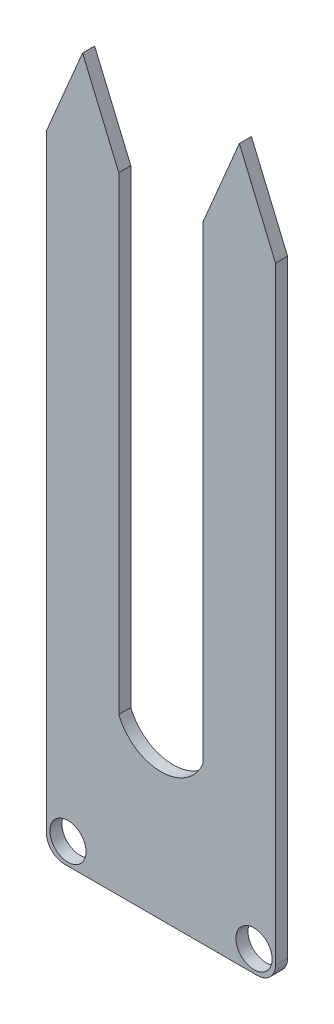
from build123d import *

# Parameters (mm, degrees)
SKETCH1_R           = 1.5005731
BOSS_EXTRUDE1_DEPTH = 1


with BuildPart() as part:
    # Sketch1 → Boss-Extrude1 (new body)
    with BuildSketch(Plane.XY):
        with BuildLine():
            Line((-7.439393939, 26.196969697), (-10.439393939, 19.101257325))
            Line((-10.439393939, 19.101257325), (-10.439393939, -19.803030303))
            Line((-10.439393939, -19.803030303), (-10.439393939, -31.303030303))
            ThreePointArc((-10.439393939, -31.303030303), (-10.000054111, -32.363690475), (-8.939393939, -32.803030303))
            Line((-8.939393939, -32.803030303), (7.060606061, -32.803030303))
            ThreePointArc((7.060606061, -32.803030303), (8.121266232, -32.363690475), (8.560606061, -31.303030303))
            Line((8.560606061, -31.303030303), (8.560606061, -19.803030303))
            Line((8.560606061, -19.803030303), (8.560606061, 19.101257325))
            Line((8.560606061, 19.101257325), (5.560606061, 26.196969697))
            Line((5.560606061, 26.196969697), (2.560606061, 19.101257325))
            Line((2.560606061, 19.101257325), (2.560606061, -19.803030303))
            ThreePointArc((2.560606061, -19.803030303), (-0.939393939, -22.171136445), (-4.439393939, -19.803030303))
            Line((-4.439393939, -19.803030303), (-4.439393939, 19.101257325))
            Line((-4.439393939, 19.101257325), (-7.439393939, 26.196969697))
        make_face()
        with Locations((-8.652229685, -31.022639869)):
            Circle(SKETCH1_R, mode=Mode.SUBTRACT)
        with Locations((6.773441806, -31.022639869)):
            Circle(SKETCH1_R, mode=Mode.SUBTRACT)
    extrude(amount=BOSS_EXTRUDE1_DEPTH)


solid = part.part
